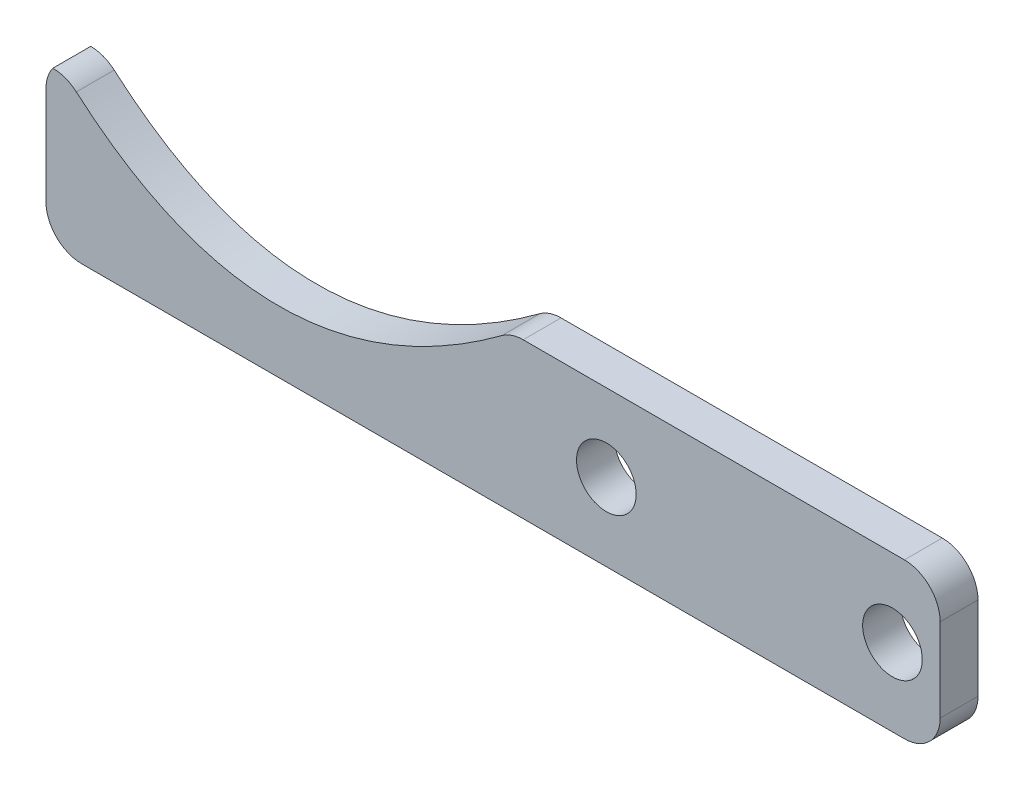
from build123d import *

# Parameters (mm, degrees)
SKETCH1_W           = 75
SKETCH1_H           = 13
SKETCH1_R           = 2.5
BOSS_EXTRUDE1_DEPTH = 3.175
CUT_EXTRUDE1_DEPTH  = 3.175
FILLET2_R           = 3
FILLET3_R           = 3


with BuildPart() as part:
    # Sketch1 → Boss-Extrude1 (new body)
    with BuildSketch(Plane.XY):
        Rectangle(SKETCH1_W, SKETCH1_H)
        with Locations((33.5, 0)):
            Circle(SKETCH1_R, mode=Mode.SUBTRACT)
        with Locations((9.5, 0)):
            Circle(SKETCH1_R, mode=Mode.SUBTRACT)
    extrude(amount=BOSS_EXTRUDE1_DEPTH)

    # Sketch3 → Cut-Extrude1 (cut)
    with BuildSketch(Plane.XY.offset(3.175)):
        with BuildLine():
            Line((-35.780363842, 6.5), (1.520225121, 6.5))
            add(Edge.make_bspline(
                [(-35.780363842, 6.5), (-18.824487267, -9.098123968), (1.520225121, 6.5)],
                knots=[0, 0, 0, 1, 1, 1], degree=2))
        make_face()
    extrude(amount=-CUT_EXTRUDE1_DEPTH, mode=Mode.SUBTRACT)

    # Fillet2
    fillet2_edges = [part.edges().sort_by_distance(p)[0] for p in [
        (-35.780363842, 6.5, 1.5875),
        (1.520225121, 6.5, 1.5875),
    ]]
    fillet(fillet2_edges, radius=FILLET2_R)

    # Fillet3
    # the kernel refuses this fillet: 3 mm, written as the material it takes off along each edge
    with BuildSketch(Plane(origin=(37.5, -6.5, -7.5), x_dir=(-1, 0, 0), z_dir=(0, 0, 1)), Plane(origin=(-37.5, -6.5, -7.5), x_dir=(0, 1, 0), z_dir=(0, 0, 1)), Plane(origin=(37.5, 6.5, -7.5), x_dir=(0, -1, 0), z_dir=(0, 0, 1))) as fillet3_piece_1:
        with BuildLine():
            CenterArc((FILLET3_R, -FILLET3_R), FILLET3_R, 90, 90)
            Line((0, -FILLET3_R), (-FILLET3_R * 0.02, -FILLET3_R))
            Line((-FILLET3_R * 0.02, -FILLET3_R), (-FILLET3_R * 0.02, FILLET3_R * 0.02))
            Line((-FILLET3_R * 0.02, FILLET3_R * 0.02), (FILLET3_R, FILLET3_R * 0.02))
            Line((FILLET3_R, FILLET3_R * 0.02), (FILLET3_R, 0))
        make_face()
    extrude(amount=18.175, mode=Mode.SUBTRACT)
    with BuildSketch(Plane(origin=(-37.5, 6.5, -4.409176768), x_dir=(1, 0, 0), z_dir=(0, 0, 1))) as fillet3_piece_2:
        with BuildLine():
            CenterArc((3, -1.763670707), FILLET3_R, 143.992564568, 36.007435432)
            Line((0, -1.763670707), (-0.06, -1.763670707))
            Line((-0.06, -1.763670707), (-0.06, 0))
            Line((-0.06, 0), (0, 0.06))
            ThreePointArc((0, 0.06), (0.286588936, 0.06), (0.52464143, 0.035273414))
            Line((0.52464143, 0.035273414), (0.573177873, 0))
        make_face()
    extrude(amount=11.993353536, mode=Mode.SUBTRACT)


solid = part.part
